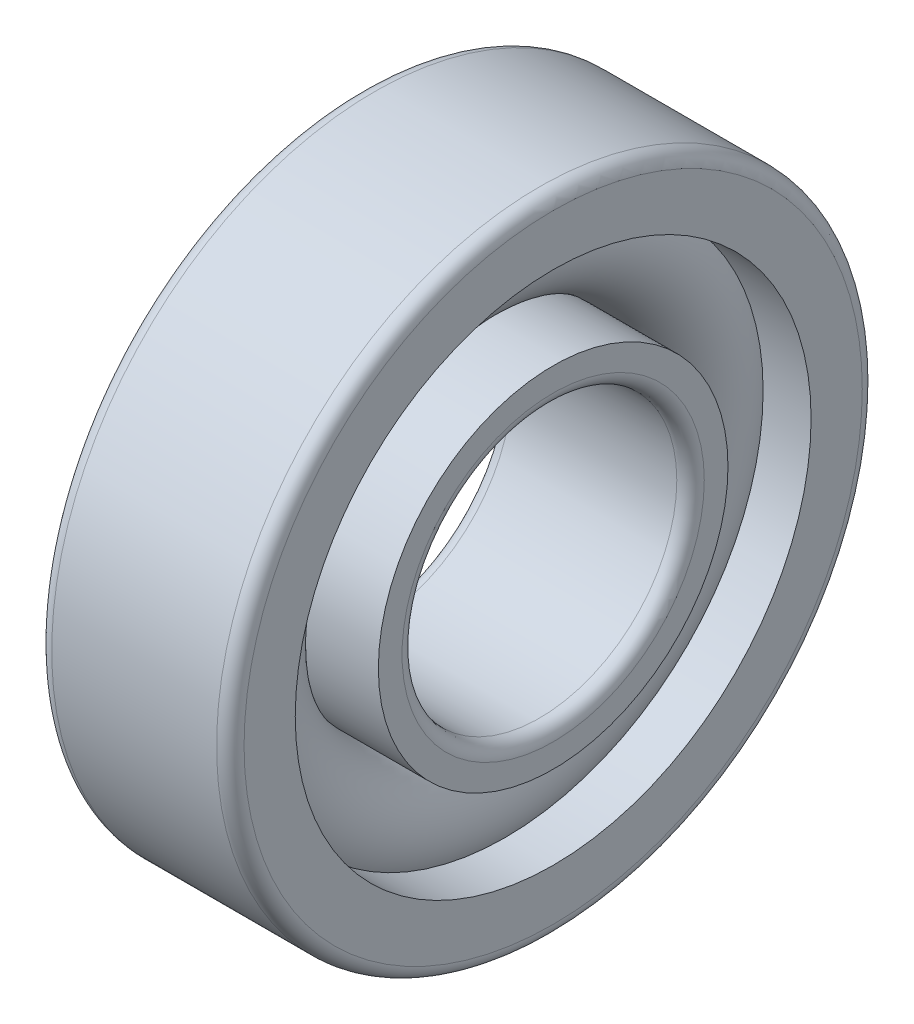
from build123d import *

# Parameters (mm, degrees)
CAGSPISKE_W     = 2.025
CAGSPISKE_H     = 1.35
CAGESPINE_ANGLE = 0.001
BALSIMSKE_R     = 4.05


with BuildPart() as part:
    # CagSpiSke → CageSpine (revolve)
    with BuildSketch(Plane.XY):
        with Locations((0, 16.75)):
            Rectangle(CAGSPISKE_W, CAGSPISKE_H)
    revolve(axis=Axis((-20.6375, 0, 0), (1, 0, 0)), revolution_arc=CAGESPINE_ANGLE)

    # BalSimSke → BallsSimplified (revolve)
    with BuildSketch(Plane.XY):
        with Locations((0, 16.75)):
            Circle(BALSIMSKE_R)
    revolve(axis=Axis((-10, 0, 0), (1, 0, 0)))

    # InnRacSke → InnerRace (revolve)
    with BuildSketch(Plane.XY):
        with BuildLine():
            Line((-3.478505426, 14.725), (-7, 14.725))
            Line((-7, 14.725), (-7, 11))
            ThreePointArc((-7, 11), (-6.707106781, 10.292893219), (-6, 10))
            Line((-6, 10), (6, 10))
            ThreePointArc((6, 10), (6.707106781, 10.292893219), (7, 11))
            Line((7, 11), (7, 12.725))
            Line((7, 12.725), (0, 12.725))
            ThreePointArc((0, 12.725), (-2.006240265, 13.260641176), (-3.478505426, 14.725))
        make_face()
    revolve(axis=Axis((-20.6375, 0, 0), (1, 0, 0)))

    # OutRacSke → OuterRace (revolve)
    with BuildSketch(Plane.XY):
        with BuildLine():
            Line((0, 20.775), (-7, 20.775))
            Line((-7, 20.775), (-7, 22.5))
            ThreePointArc((-7, 22.5), (-6.707106781, 23.207106781), (-6, 23.5))
            Line((-6, 23.5), (6, 23.5))
            ThreePointArc((6, 23.5), (6.707106781, 23.207106781), (7, 22.5))
            Line((7, 22.5), (7, 18.775))
            Line((7, 18.775), (3.478505426, 18.775))
            ThreePointArc((3.478505426, 18.775), (2.006240265, 20.239358824), (0, 20.775))
        make_face()
    revolve(axis=Axis((-20.6375, 0, 0), (1, 0, 0)))


solid = part.part
